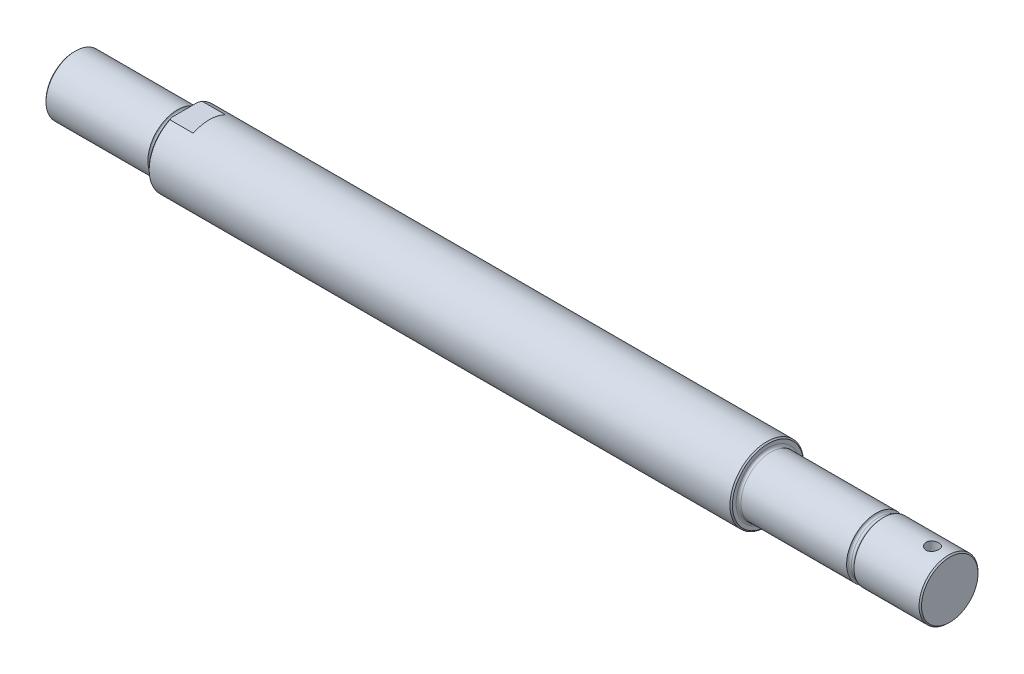
from build123d import *

# Parameters (mm, degrees)
SKETCH1_W               = 356.5
SKETCH1_H               = 15
SKETCH2_W               = 3
SKETCH2_H               = 1
CUT_EXTRUDE1_DEPTH      = 180.507834091
CUT_EXTRUDE1_DEPTH_BACK = 180.507834091
SKETCH3_R               = 2.6
CUT_EXTRUDE2_DEPTH      = 180.50783419
CUT_EXTRUDE2_DEPTH_BACK = 180.50783419
SKETCH4_W               = 10
SKETCH4_H               = 1.5
FILLET1_R               = 1
CHAMFER1_SIZE           = 0.5


with BuildPart() as part:
    # Sketch1 → Revolve1 (revolve)
    with BuildSketch(Plane.XY, mode=Mode.PRIVATE) as revolve1_sk:
        with Locations((0, 7.5)):
            Rectangle(SKETCH1_W, SKETCH1_H)
    revolve(revolve1_sk.sketch.rotate(Axis((-178.25, 0, 0), (1, 0, 0)), 90), axis=Axis((-178.25, 0, 0), (1, 0, 0)))

    # Sketch2 → Cut-Revolve1 (revolve, cut)
    with BuildSketch(Plane.XY):
        Polygon((178.25, 12), (178.25, 15), (104.25, 15), (104.25, 12), (148.25, 12), (151.25, 12), align=None)
        with Locations((149.75, 11.5)):
            Rectangle(SKETCH2_W, SKETCH2_H)
        Polygon((-133.25, 15), (-178.25, 15), (-178.25, 12), (-136.25, 12), (-133.25, 12), align=None)
        with Locations((-134.75, 11.5)):
            Rectangle(SKETCH2_W, SKETCH2_H)
    revolve(axis=Axis((178.25, 0, 0), (-1, 0, 0)), mode=Mode.SUBTRACT)

    # Sketch3 → Cut-Extrude1 (cut, two sides: drawn at the far end of the back side and taken through both)
    with BuildSketch(Plane(origin=(0, 0, 0), x_dir=(1, 0, 0), z_dir=(0, 1, 0)).offset(-CUT_EXTRUDE1_DEPTH_BACK)):
        with Locations(Location((171.25, 0, 0), (0, 0, 270))):
            Circle(SKETCH3_R)
    extrude(amount=CUT_EXTRUDE1_DEPTH + CUT_EXTRUDE1_DEPTH_BACK, mode=Mode.SUBTRACT)

    # Sketch4 → Cut-Extrude2 (cut, two sides: drawn at the far end of the back side and taken through both)
    with BuildSketch(Plane.XY.offset(-CUT_EXTRUDE2_DEPTH_BACK)):
        with Locations((-128.25, 14.25)):
            Rectangle(SKETCH4_W, SKETCH4_H)
        with Locations((-128.25, -14.25)):
            Rectangle(SKETCH4_W, SKETCH4_H)
    extrude(amount=CUT_EXTRUDE2_DEPTH + CUT_EXTRUDE2_DEPTH_BACK, mode=Mode.SUBTRACT)

    # Fillet1
    fillet1_edges = [part.edges().sort_by_distance(p)[0] for p in [
        (104.25, -12, 0),
        (151.25, -11, 0),
        (148.25, -11, 0),
        (-133.25, -11, 0),
        (-136.25, -11, 0),
    ]]
    fillet(fillet1_edges, radius=FILLET1_R - 0.0001)  # a hair under: the kernel refuses the full size

    # Chamfer1
    chamfer1_edges = [part.edges().sort_by_distance(p)[0] for p in [
        (178.25, -12, 0),
        (104.25, 0, -15),
        (-178.25, -12, 0),
        (-133.25, -7.966328319, 12.709744809),
        (-133.25, 0, -15),
    ]]
    chamfer(chamfer1_edges, length=CHAMFER1_SIZE)


solid = part.part
